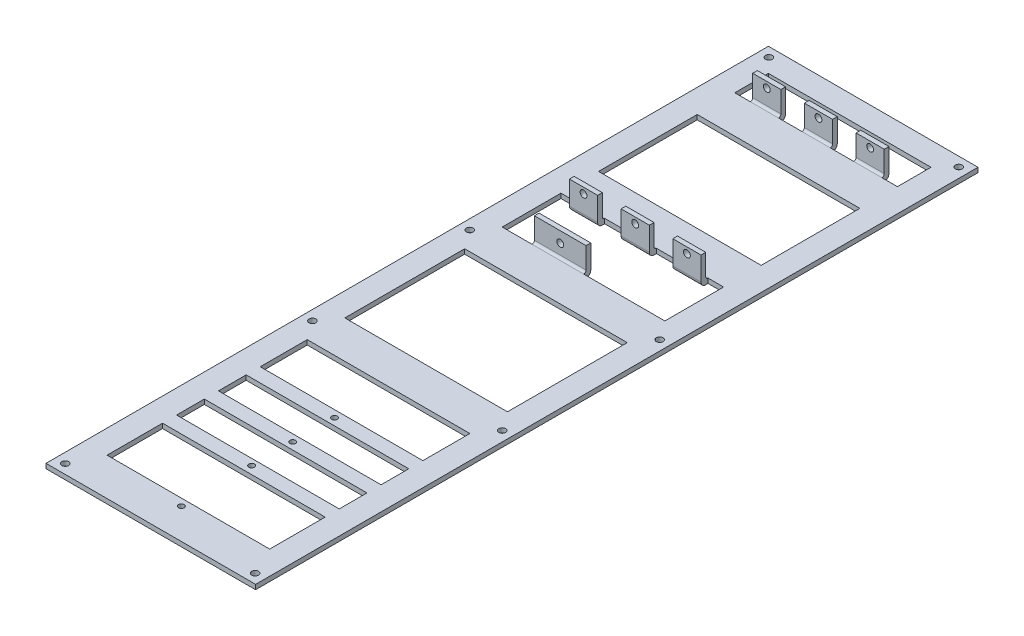
from build123d import *

# Parameters (mm, degrees)
SKETCH1_W                      = 89.225
SKETCH1_H                      = 307.5
SKETCH1_W_2                    = 69.225
SKETCH1_H_2                    = 42
SKETCH1_H_3                    = 20
SKETCH1_H_4                    = 51
SKETCH1_H_5                    = 14.3
SKETCH1_H_6                    = 25
BOSS_EXTRUDE1_DEPTH            = 2
SKETCH20_W                     = 22
SKETCH20_H                     = 1
BOSS_EXTRUDE7_DEPTH            = 2
SKETCH21_W                     = 22
SKETCH21_H                     = 2
BOSS_EXTRUDE8_DEPTH            = 12
FILLET7_R                      = 2
FILLET8_R                      = 1
M2_5_CLEARANCE_HOLE3_D         = 2.9
SKETCH28_W                     = 12
SKETCH28_H                     = 1
BOSS_EXTRUDE11_DEPTH           = 2
SKETCH29_W                     = 12
SKETCH29_H                     = 2
BOSS_EXTRUDE12_DEPTH           = 12
FILLET11_R                     = 2
FILLET12_R                     = 1
M2_5_START                     = -286.2
M2_5_CLEARANCE_HOLE5_OUTLINE_R = 1.45
M2_5_CLEARANCE_HOLE5_DEPTH     = 80
M2_5_CLEARANCE_HOLE6_D         = 2.9
M2_CLEARANCE_HOLE1_D           = 2.4
M2_CLEARANCE_HOLE3_D           = 2.4


# Read off the part's stored shape, not the designer's step: M2.5 Clearance Hole5
with BuildPart() as part:
    # Sketch1 → Boss-Extrude1 (new body)
    with BuildSketch(Plane(origin=(0, 0, 0), x_dir=(1, 0, 0), z_dir=(0, 1, 0))):
        with Locations((44.6125, 153.75)):
            Rectangle(SKETCH1_W, SKETCH1_H)
        with Locations((44.6125, 246.2)):
            Rectangle(SKETCH1_W_2, SKETCH1_H_2, mode=Mode.SUBTRACT)
        Polygon((10, 16), (79.225, 16), (79.225, 21.8), (79.225, 27.8), (79.225, 39.6), (56.6125, 39.6), (32.6125, 39.6), (10, 39.6), (10, 27.8), align=None, mode=Mode.SUBTRACT)
        Polygon((10, 45.6), (79.225, 45.6), (79.225, 57.4), (56.6125, 57.4), (32.6125, 57.4), (10, 57.4), align=None, mode=Mode.SUBTRACT)
        Polygon((10, 63.4), (79.225, 63.4), (79.225, 75.2), (56.6125, 75.2), (32.6125, 75.2), (10, 75.2), align=None, mode=Mode.SUBTRACT)
        with Locations((44.6125, 91.2)):
            Rectangle(SKETCH1_W_2, SKETCH1_H_3, mode=Mode.SUBTRACT)
        with Locations((44.6125, 142.7)):
            Rectangle(SKETCH1_W_2, SKETCH1_H_4, mode=Mode.SUBTRACT)
        with Locations((44.6125, 290.35)):
            Rectangle(SKETCH1_W_2, SKETCH1_H_5, mode=Mode.SUBTRACT)
        with Locations((44.6125, 196.7)):
            Rectangle(SKETCH1_W_2, SKETCH1_H_6, mode=Mode.SUBTRACT)
    extrude(amount=BOSS_EXTRUDE1_DEPTH)

    # Sketch20 → Boss-Extrude7 (add)
    with BuildSketch(Plane(origin=(0, 0, 0), x_dir=(1, 0, 0), z_dir=(0, 1, 0))):
        with Locations((33.7, 184.7)):
            Rectangle(SKETCH20_W, SKETCH20_H)
    extrude(amount=BOSS_EXTRUDE7_DEPTH)

    # Sketch21 → Boss-Extrude8 (add)
    with BuildSketch(Plane(origin=(0, 0, 0), x_dir=(1, 0, 0), z_dir=(0, 1, 0))):
        with Locations((33.7, 186.2)):
            Rectangle(SKETCH21_W, SKETCH21_H)
    extrude(amount=BOSS_EXTRUDE8_DEPTH)

    # Fillet7
    fillet7_edges = [part.edges().sort_by_distance(p)[0] for p in [
        (33.7, 0, -187.2),
    ]]
    fillet(fillet7_edges, radius=FILLET7_R)

    # Fillet8
    fillet8_edges = [part.edges().sort_by_distance(p)[0] for p in [
        (33.7, 2, -185.2),
    ]]
    fillet(fillet8_edges, radius=FILLET8_R)

    # M2.5 Clearance Hole3 (through all)
    with Locations(Plane.XY.offset(-185.2)):
        with Locations((33.7, 7.4125)):
            Hole(M2_5_CLEARANCE_HOLE3_D / 2)

    # Sketch28 → Boss-Extrude11 (add)
    with BuildSketch(Plane(origin=(0, 0, 0), x_dir=(1, 0, 0), z_dir=(0, 1, 0))):
        with Locations((66.6125, 208.7)):
            Rectangle(SKETCH28_W, SKETCH28_H)
        with Locations((44.6125, 208.7)):
            Rectangle(SKETCH28_W, SKETCH28_H)
        with Locations((22.6125, 208.7)):
            Rectangle(SKETCH28_W, SKETCH28_H)
        with Locations((66.6125, 283.7)):
            Rectangle(SKETCH28_W, SKETCH28_H)
        with Locations((44.6125, 283.7)):
            Rectangle(SKETCH28_W, SKETCH28_H)
        with Locations((22.6125, 283.7)):
            Rectangle(SKETCH28_W, SKETCH28_H)
    extrude(amount=BOSS_EXTRUDE11_DEPTH)

    # Sketch29 → Boss-Extrude12 (add)
    with BuildSketch(Plane(origin=(0, 0, 0), x_dir=(1, 0, 0), z_dir=(0, 1, 0))):
        with Locations((66.6125, 207.2)):
            Rectangle(SKETCH29_W, SKETCH29_H)
        with Locations((44.6125, 207.2)):
            Rectangle(SKETCH29_W, SKETCH29_H)
        with Locations((22.6125, 207.2)):
            Rectangle(SKETCH29_W, SKETCH29_H)
        with Locations((66.6125, 285.2)):
            Rectangle(SKETCH29_W, SKETCH29_H)
        with Locations((44.6125, 285.2)):
            Rectangle(SKETCH29_W, SKETCH29_H)
        with Locations((22.6125, 285.2)):
            Rectangle(SKETCH29_W, SKETCH29_H)
    extrude(amount=BOSS_EXTRUDE12_DEPTH)

    # Fillet11
    fillet11_edges = [part.edges().sort_by_distance(p)[0] for p in [
        (66.6125, 0, -206.2),
        (44.6125, 0, -206.2),
        (22.6125, 0, -206.2),
        (66.6125, 0, -286.2),
        (44.6125, 0, -286.2),
        (22.6125, 0, -286.2),
    ]]
    fillet(fillet11_edges, radius=FILLET11_R)

    # Fillet12
    fillet12_edges = [part.edges().sort_by_distance(p)[0] for p in [
        (22.6125, 2, -284.2),
        (44.6125, 2, -284.2),
        (66.6125, 2, -284.2),
        (66.6125, 2, -208.2),
        (44.6125, 2, -208.2),
        (22.6125, 2, -208.2),
    ]]
    fillet(fillet12_edges, radius=FILLET12_R)

    # M2.5 Clearance Hole5 outline → M2.5 Clearance Hole5 (cut)
    with BuildSketch(Plane.XY.offset(M2_5_START)):
        with Locations((22.6125, 9.5)):
            Circle(M2_5_CLEARANCE_HOLE5_OUTLINE_R)
        with Locations((44.6125, 9.5)):
            Circle(M2_5_CLEARANCE_HOLE5_OUTLINE_R)
        with Locations((66.6125, 9.5)):
            Circle(M2_5_CLEARANCE_HOLE5_OUTLINE_R)
    extrude(amount=M2_5_CLEARANCE_HOLE5_DEPTH, mode=Mode.SUBTRACT)

    # M2.5 Clearance Hole6 (through all)
    with Locations(Plane(origin=(0, 2, 0), x_dir=(1, 0, 0), z_dir=(0, 1, 0))):
        with Locations((85.025, 4), (4.2, 4), (4.2, 109.2), (4.2, 176.2), (4.2, 303.5), (85.025, 303.5), (85.025, 176.2), (85.025, 109.2)):
            Hole(M2_5_CLEARANCE_HOLE6_D / 2)

    # M2 Clearance Hole1 (through all)
    with Locations(Plane(origin=(0, 0, 0), x_dir=(-1, 0, 0), z_dir=(0, -1, 0))):
        with Locations((-44.6125, 24.8), (-44.6125, 42.9), (-44.6125, 60.4), (-44.6125, 78.2)):
            Hole(M2_CLEARANCE_HOLE1_D / 2)

    # M2 Clearance Hole3 (through all)
    with Locations(Plane(origin=(0, 0, 0), x_dir=(-1, 0, 0), z_dir=(0, -1, 0))):
        with Locations((-44.6125, 13)):
            Hole(M2_CLEARANCE_HOLE3_D / 2)


solid = part.part
